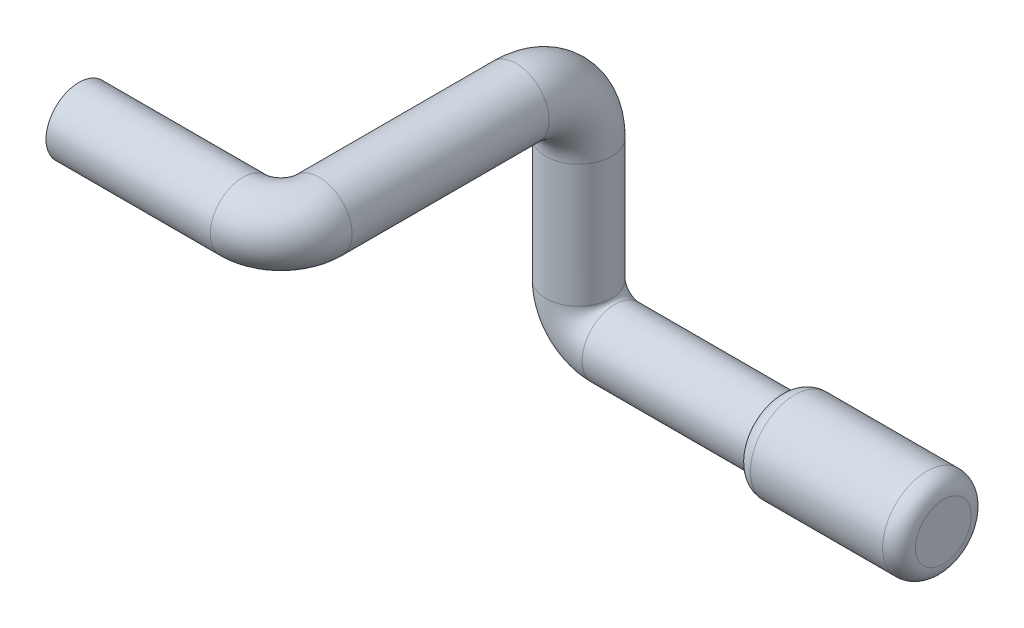
from build123d import *

# Parameters (mm, degrees)
SKETCH6_R           = 5.08
SKETCH7_R           = 6.858
BOSS_EXTRUDE1_DEPTH = 25.4
FILLET1_R           = 2.54


with BuildPart() as part:
    # Sweep1: sweep along a curve in space
    with BuildLine() as sweep1_path:
        Line((0, 0, 0), (25.4, 0, 0))
        ThreePointArc((25.4, 0, 0), (29.562920183, 0, -1.724337999), (31.287258182, 0, -5.887258182))
        Line((31.287258182, 0, -5.887258182), (31.287258182, 0, -36.367258182))
        ThreePointArc((31.287258182, 0, -36.367258182), (31.287258182, -2.832027095, -43.204376403), (31.287258182, -9.669145315, -46.036403497))
        Line((31.287258182, -9.669145315, -46.036403497), (31.287258182, -28.692102311, -46.036403497))
        ThreePointArc((31.287258182, -28.692102311, -46.036403497), (32.927182179, -32.651229067, -46.036403497), (36.886308936, -34.291153065, -46.036403497))
        Line((36.886308936, -34.291153065, -46.036403497), (62.286308936, -34.291153065, -46.036403497))
    # Sketch6 → Sweep1 (sweep)
    with BuildSketch(Plane(origin=(0, 0, 0), x_dir=(0, 0, -1), z_dir=(1, 0, 0))):
        Circle(SKETCH6_R)
    sweep(path=sweep1_path.line)

    # Sketch7 → Boss-Extrude1 (add)
    with BuildSketch(Plane(origin=(62.286308936, 0, 0), x_dir=(0, 0, -1), z_dir=(1, 0, 0))):
        with Locations(Location((46.036403497, -34.291153065, 0), (0, 0, 270))):
            Circle(SKETCH7_R)
    extrude(amount=BOSS_EXTRUDE1_DEPTH)

    # Fillet1
    # the kernel refuses this fillet: 2.54 mm, written as the material it takes off along each edge
    with BuildSketch(Plane(origin=(62.286308936, -34.291153065, -46.036403497), x_dir=(0, -1, 0), z_dir=(0, 0, 1))) as fillet1_piece_1:
        with BuildLine():
            CenterArc((4.318, 2.423005572), FILLET1_R, 287.457603124, 72.542396876)
            Line((5.08, 0), (5.09524, -0.048460111))
            ThreePointArc((5.09524, -0.048460111), (5.969, -0.0508), (6.858, -0.0508))
            Line((6.858, -0.0508), (6.9088, 0))
            Line((6.9088, 0), (6.9088, 2.423005572))
            Line((6.9088, 2.423005572), (6.858, 2.423005572))
        make_face()
    revolve(axis=Axis((62.286308936, -34.291153065, -46.036403497), (1, 0, 0)), mode=Mode.SUBTRACT)
    with BuildSketch(Plane(origin=(87.686308936, -34.291153065, -46.036403497), x_dir=(0, -1, 0), z_dir=(0, 0, 1))) as fillet1_piece_2:
        with BuildLine():
            CenterArc((6.858 - FILLET1_R, -FILLET1_R), FILLET1_R, 0, 90)
            Line((6.858 - FILLET1_R, 0), (6.858 - FILLET1_R, FILLET1_R * 0.02))
            Line((6.858 - FILLET1_R, FILLET1_R * 0.02), (6.858 + FILLET1_R * 0.02, FILLET1_R * 0.02))
            Line((6.858 + FILLET1_R * 0.02, FILLET1_R * 0.02), (6.858 + FILLET1_R * 0.02, -FILLET1_R))
            Line((6.858 + FILLET1_R * 0.02, -FILLET1_R), (6.858, -FILLET1_R))
        make_face()
    revolve(axis=Axis((87.686308936, -34.291153065, -46.036403497), (1, 0, 0)), mode=Mode.SUBTRACT)


solid = part.part
